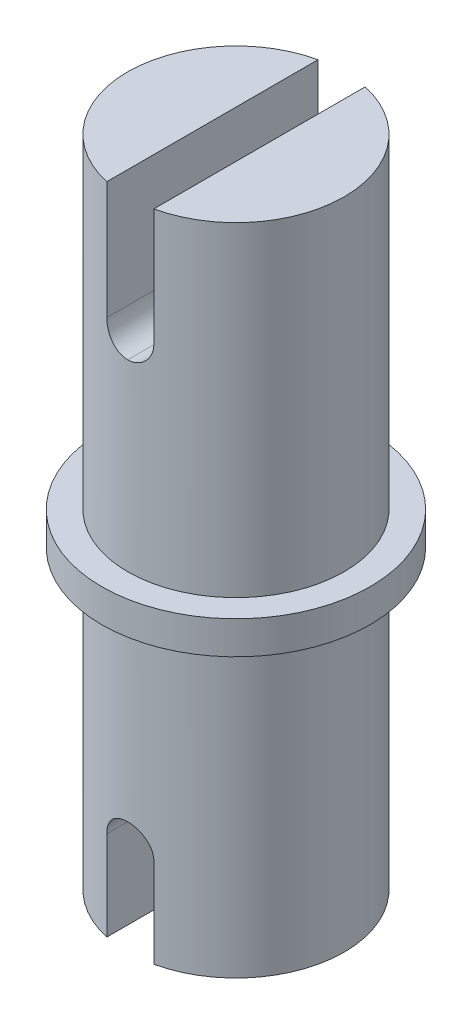
from build123d import *

# Parameters (mm, degrees)
SKETCH2_R            = 2.85
BOSS_EXTRUDE1_DEPTH  = 0.35
SKETCH4_R            = 2.3
BOSS_EXTRUDE2_DEPTH  = 6.9
CUT_EXTRUDE1_START   = -3
CUT_EXTRUDE1_DEPTH   = 3
FILLET1_R            = 0.5
FILLET1_OF_MIRROR1_R = 0.5
CUT_EXTRUDE2_DEPTH   = 0.6


with BuildPart() as part:
    # Sketch2 → Boss-Extrude1 (new body)
    with BuildSketch(Plane(origin=(0, 0, 0), x_dir=(1, 0, 0), z_dir=(0, 1, 0))):
        with Locations(Location((0, 0, 0), (0, 0, 270))):
            Circle(SKETCH2_R)
    boss_extrude1 = extrude(amount=BOSS_EXTRUDE1_DEPTH)

    # Sketch4 → Boss-Extrude2 (add)
    with BuildSketch(Plane(origin=(0, 0.35, 0), x_dir=(1, 0, 0), z_dir=(0, 1, 0))):
        with Locations(Location((0, 0, 0), (0, 0, 90))):
            Circle(SKETCH4_R)
    boss_extrude2 = extrude(amount=BOSS_EXTRUDE2_DEPTH)

    # Sketch5 → Cut-Extrude1 (cut)
    with BuildSketch(Plane(origin=(0, 7.25, 0), x_dir=(1, 0, 0), z_dir=(0, 1, 0)).offset(CUT_EXTRUDE1_START)):
        with BuildLine():
            Line((-0.5, 2.244994432), (-0.5, -2.244994432))
            ThreePointArc((-0.5, -2.244994432), (0, -2.3), (0.5, -2.244994432))
            Line((0.5, -2.244994432), (0.5, 2.244994432))
            ThreePointArc((0.5, 2.244994432), (0, 2.3), (-0.5, 2.244994432))
        make_face()
    cut_extrude1 = extrude(amount=CUT_EXTRUDE1_DEPTH, mode=Mode.SUBTRACT)

    # Fillet1
    fillet1_edges = [part.edges().sort_by_distance(p)[0] for p in [
        (0.5, 4.25, 0),
        (-0.5, 4.25, 0),
    ]]
    fillet(fillet1_edges, radius=FILLET1_R - 0.0001)  # a hair under: the kernel refuses the full size

    # Mirror1: Boss-Extrude1, Boss-Extrude2, Cut-Extrude1 across plane
    add(boss_extrude1.mirror(Plane.ZX))
    add(boss_extrude2.mirror(Plane.ZX))
    add(cut_extrude1.mirror(Plane.ZX), mode=Mode.SUBTRACT)

    # Fillet1 of Mirror1
    fillet1_of_mirror1_edges = [part.edges().sort_by_distance(p)[0] for p in [
        (0.5, -4.25, 0),
        (-0.5, -4.25, 0),
    ]]
    fillet(fillet1_of_mirror1_edges, radius=FILLET1_OF_MIRROR1_R - 0.0001)  # a hair under: the kernel refuses the full size

    # Sketch6 → Cut-Extrude2 (cut)
    with BuildSketch(Plane(origin=(0, -7.25, 0), x_dir=(-1, 0, 0), z_dir=(0, -1, 0))):
        with BuildLine():
            ThreePointArc((0.5, -2.244994432), (2.244994432, 0.5), (-0.5, 2.244994432))
            ThreePointArc((-0.5, 2.244994432), (-2.244994432, -0.5), (0.5, -2.244994432))
        make_face()
    extrude(amount=-CUT_EXTRUDE2_DEPTH, mode=Mode.SUBTRACT)


solid = part.part
